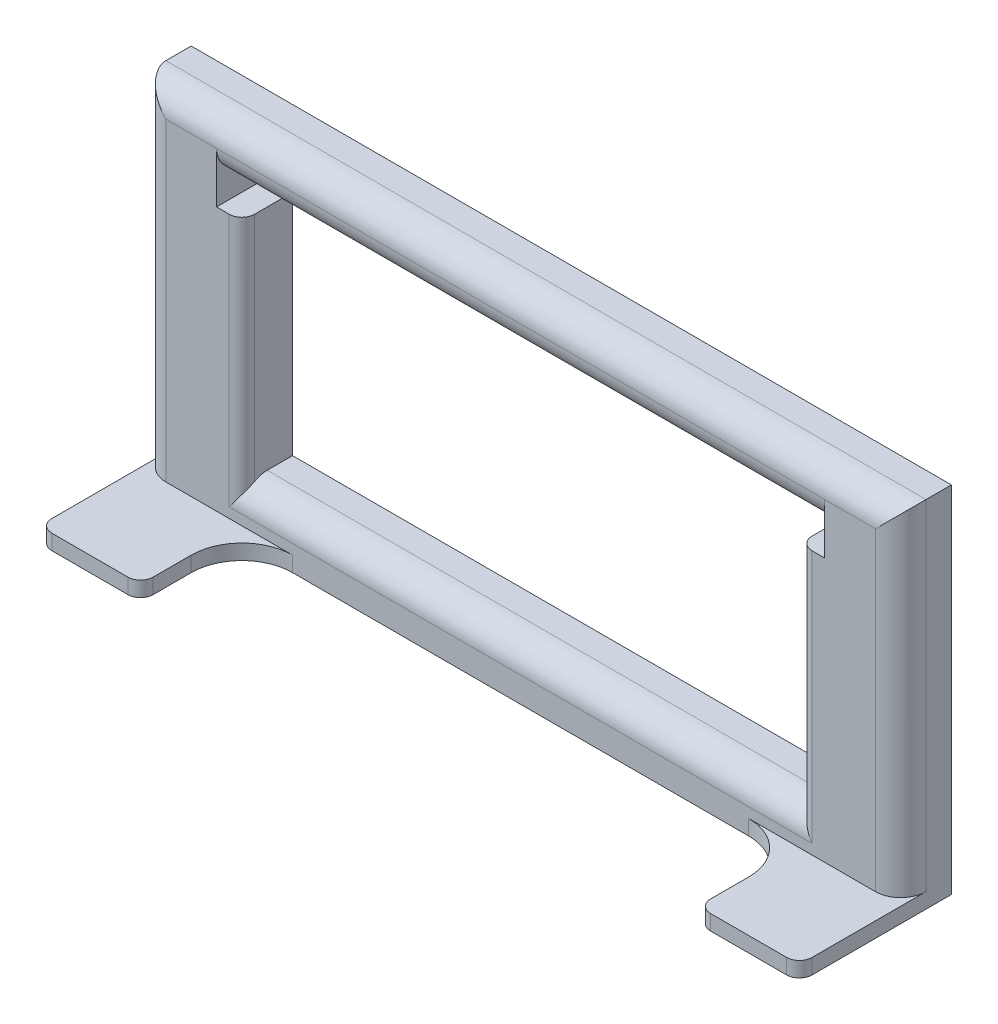
from build123d import *

# Parameters (mm, degrees)
SKETCH1_W           = 150
SKETCH1_H           = 70
BOSS_EXTRUDE1_DEPTH = 10
SKETCH2_W           = 150
SKETCH2_H           = 3
BOSS_EXTRUDE2_DEPTH = 20
SKETCH3_W           = 110
SKETCH3_H           = 20
CUT_EXTRUDE1_DEPTH  = 105.947605976
FILLET1_R           = 5
FILLET2_R           = 10
FILLET3_R           = 2.5


with BuildPart() as part:
    # Sketch1 → Boss-Extrude1 (new body)
    with BuildSketch(Plane.XY):
        Rectangle(SKETCH1_W, SKETCH1_H)
        Polygon((-60, 25), (-55, 25), (55, 25), (60, 25), (60, 20), (55, 20), (55, -25), (-55, -25), (-55, 20), (-60, 20), align=None, mode=Mode.SUBTRACT)
    extrude(amount=BOSS_EXTRUDE1_DEPTH)

    # Sketch2 → Boss-Extrude2 (add)
    with BuildSketch(Plane.XY.offset(10)):
        with Locations((0, -33.5)):
            Rectangle(SKETCH2_W, SKETCH2_H)
    extrude(amount=BOSS_EXTRUDE2_DEPTH)

    # Sketch3 → Cut-Extrude1 (cut, through all)
    with BuildSketch(Plane(origin=(0, -32, 0), x_dir=(1, 0, 0), z_dir=(0, 1, 0))):
        with Locations((0, -20)):
            Rectangle(SKETCH3_W, SKETCH3_H)
    extrude(amount=-CUT_EXTRUDE1_DEPTH, mode=Mode.SUBTRACT)

    # Fillet1
    fillet1_edges = [part.edges().sort_by_distance(p)[0] for p in [
        (0, 25, 10),
        (0, -25, 10),
        (75, 1.5, 10),
        (0, 35, 10),
        (-75, 1.5, 10),
    ]]
    fillet(fillet1_edges, radius=FILLET1_R - 0.0001)  # a hair under: the kernel refuses the full size

    # Fillet2
    fillet2_edges = [part.edges().sort_by_distance(p)[0] for p in [
        (55, -33.5, 10),
        (-55, -33.5, 10),
    ]]
    fillet(fillet2_edges, radius=FILLET2_R)

    # Fillet3
    fillet3_edges = [part.edges().sort_by_distance(p)[0] for p in [
        (55, -4.99995, 10),
        (-55, -4.99995, 10),
        (-75, -33.5, 30),
        (75, -33.5, 30),
        (55, -33.5, 30),
        (-55, -33.5, 30),
    ]]
    fillet(fillet3_edges, radius=FILLET3_R)


solid = part.part
